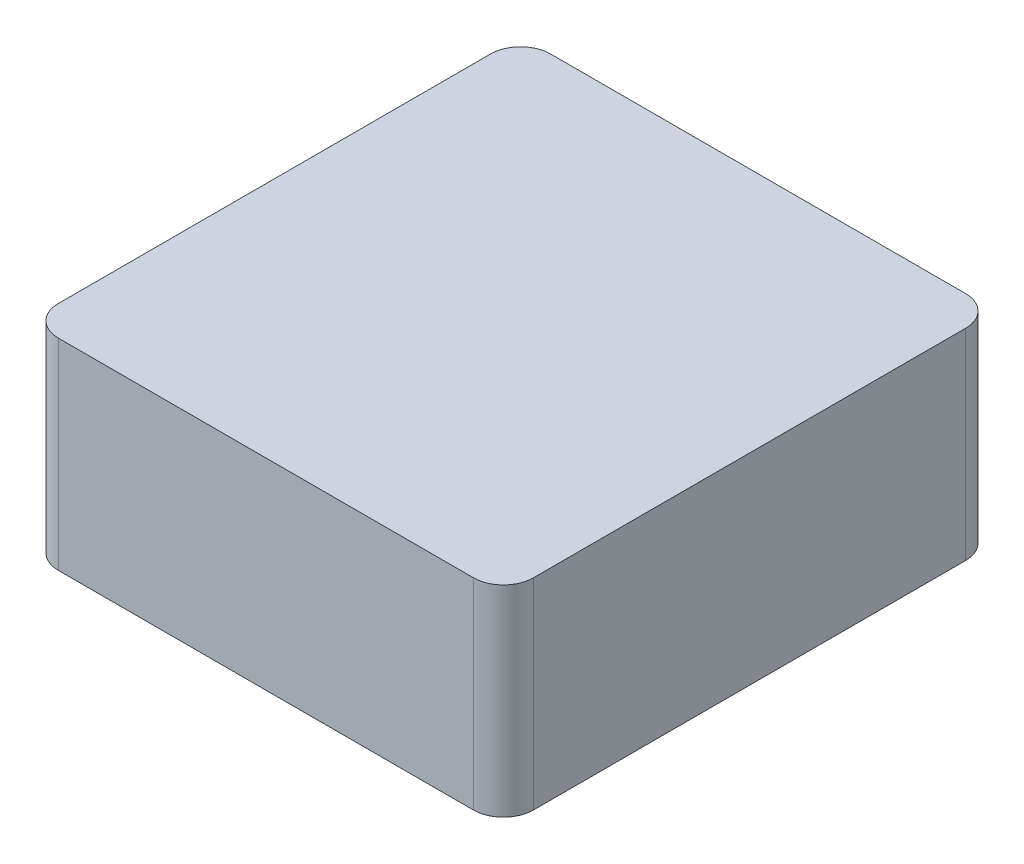
from build123d import *

# Parameters (mm, degrees)
BOSS_EXTRUDE1_DEPTH       = 23.5
SKETCH4_R                 = 6
BOSS_EXTRUDE2_DEPTH       = 3.25
M3X0_5_TAPPED_HOLE1_D     = 2.5
M3X0_5_TAPPED_HOLE1_DEPTH = 4.5
M3X0_5_TAPPED_HOLE1_TIP   = 0.751075774


with BuildPart() as part:
    # Sketch3 → Boss-Extrude1 (new, symmetric)
    with BuildSketch(Plane(origin=(0, 0, 0), x_dir=(1, 0, 0), z_dir=(0, 1, 0))):
        with BuildLine():
            Line((-48.5, 57.5), (48.5, 57.5))
            ThreePointArc((48.5, 57.5), (53.449747468, 55.449747468), (55.5, 50.5))
            Line((55.5, 50.5), (55.5, -50.5))
            ThreePointArc((55.5, -50.5), (53.449747468, -55.449747468), (48.5, -57.5))
            Line((48.5, -57.5), (-48.5, -57.5))
            ThreePointArc((-48.5, -57.5), (-53.449747468, -55.449747468), (-55.5, -50.5))
            Line((-55.5, -50.5), (-55.5, 50.5))
            ThreePointArc((-55.5, 50.5), (-53.449747468, 55.449747468), (-48.5, 57.5))
        make_face()
    extrude(amount=BOSS_EXTRUDE1_DEPTH, both=True)

    # Sketch4 → Boss-Extrude2 (add)
    with BuildSketch(Plane.XZ.offset(23.5)):
        with Locations((45, 47.5)):
            Circle(SKETCH4_R)
        with Locations((-45, 47.5)):
            Circle(SKETCH4_R)
        with Locations((-45, -47.5)):
            Circle(SKETCH4_R)
        with Locations((45, -47.5)):
            Circle(SKETCH4_R)
    extrude(amount=BOSS_EXTRUDE2_DEPTH)

    # M3x0.5 Tapped Hole1
    with Locations(Plane(origin=(0, -23.5, 0), x_dir=(-1, 0, 0), z_dir=(0, -1, 0))):
        with Locations((-42.5, 0), (42.5, 0)):
            Hole(M3X0_5_TAPPED_HOLE1_D / 2, depth=M3X0_5_TAPPED_HOLE1_DEPTH)
            with Locations((0, 0, -(M3X0_5_TAPPED_HOLE1_DEPTH + M3X0_5_TAPPED_HOLE1_TIP / 2))):  # 118° drill point
                Cone(0, M3X0_5_TAPPED_HOLE1_D / 2, M3X0_5_TAPPED_HOLE1_TIP, mode=Mode.SUBTRACT)


solid = part.part
